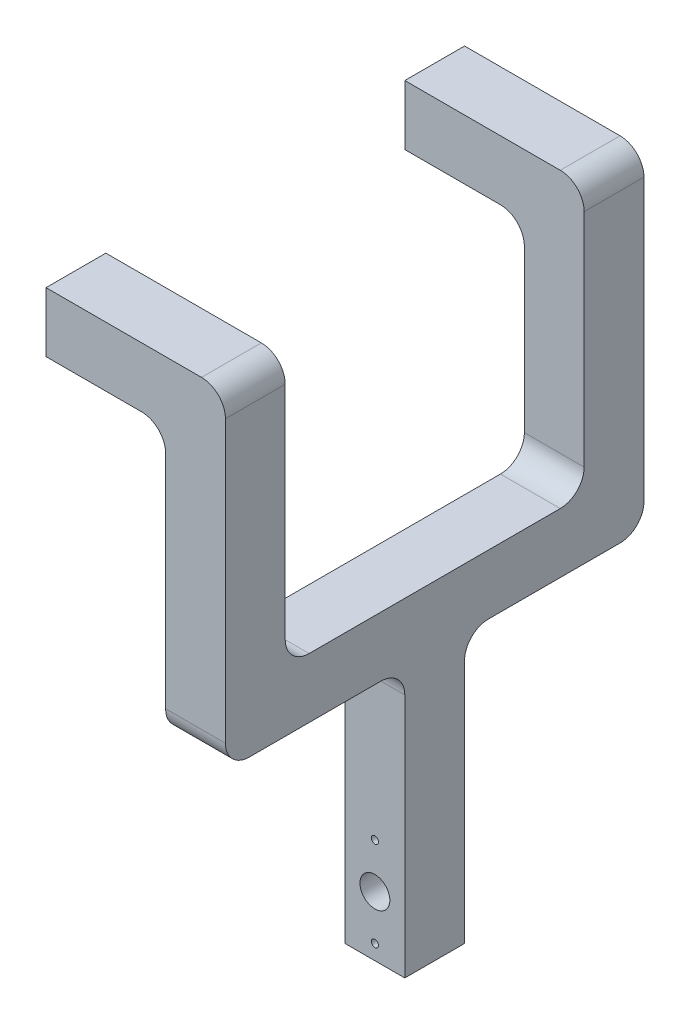
from build123d import *

# Parameters (mm, degrees)
ESQUISSE1_W        = 10
ESQUISSE1_H        = 55
ESQUISSE1_R        = 2.5
ESQUISSE1_R_2      = 0.5
BOSS_EXTRU_1_DEPTH = 10
BOSS_EXTRU_2_DEPTH = 10
ESQUISSE5_W        = 10
ESQUISSE5_H        = 10
BOSS_EXTRU_3_DEPTH = 20
CONG_1_R           = 4
D_GAGEMENT_M11_D   = 1.2


with BuildPart() as part:
    # Esquisse1 → Boss.-Extru.1 (new body)
    with BuildSketch(Plane.XY):
        with Locations((9, 27.5)):
            Rectangle(ESQUISSE1_W, ESQUISSE1_H)
        with Locations((9, 10)):
            Circle(ESQUISSE1_R, mode=Mode.SUBTRACT)
        with Locations((9, 17.5)):
            Circle(ESQUISSE1_R_2, mode=Mode.SUBTRACT)
        with Locations((9, 2.5)):
            Circle(ESQUISSE1_R_2, mode=Mode.SUBTRACT)
    extrude(amount=BOSS_EXTRU_1_DEPTH)

    # Esquisse4 → Boss.-Extru.2 (add)
    with BuildSketch(Plane(origin=(14, 0, 0), x_dir=(0, 0, -1), z_dir=(1, 0, 0))):
        Polygon((-30, 55), (20, 55), (20, 100), (30, 100), (30, 45), (-40, 45), (-40, 100), (-30, 100), align=None)
    extrude(amount=-BOSS_EXTRU_2_DEPTH)

    # Esquisse5 → Boss.-Extru.3 (add)
    with BuildSketch(Plane.ZY.offset(-4)):
        with Locations((-25, 95)):
            Rectangle(ESQUISSE5_W, ESQUISSE5_H)
        with Locations((35, 95)):
            Rectangle(ESQUISSE5_W, ESQUISSE5_H)
    extrude(amount=BOSS_EXTRU_3_DEPTH)

    # Congé1
    cong_1_edges = [part.edges().sort_by_distance(p)[0] for p in [
        (9, 55, -20),
        (9, 55, 30),
        (4, 90, -25),
        (4, 90, 35),
        (9, 45, -30),
        (9, 45, 40),
        (14, 100, -25),
        (14, 100, 35),
        (9, 45, 0),
        (9, 45, 10),
    ]]
    fillet(cong_1_edges, radius=CONG_1_R)

    # Dégagement M11 (through all)
    with Locations(Plane.XY.offset(10)):
        with Locations((9, 17.5), (9, 2.5)):
            Hole(D_GAGEMENT_M11_D / 2)


solid = part.part
